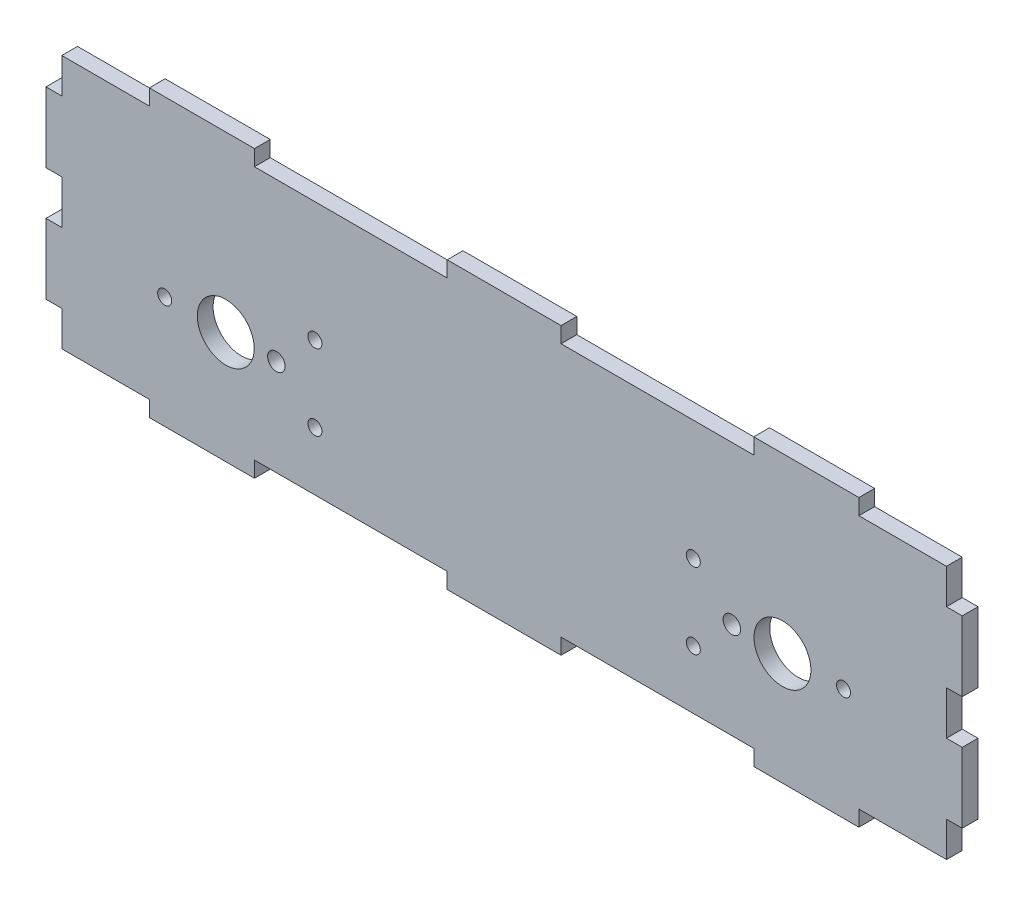
from build123d import *

# Parameters (mm, degrees)
SKETCH_1_W             = 170
SKETCH_1_H             = 48
SKETCH_1_R             = 2
SKETCH_1_R_2           = 6.5
SKETCH_1_R_3           = 1.6
SM_BASE_FLANGE_1_DEPTH = 3.6
SKETCH_7_W             = 16
SKETCH_7_H             = 48
EXTRUDE_1_DEPTH        = 3.6
SKETCH_8_W             = 202
SKETCH_8_H             = 10
EXTRUDE_2_DEPTH        = 3.6
SKETCH_9_W             = 3.6
SKETCH_9_H             = 16
SKETCH_9_W_2           = 24
SKETCH_9_H_2           = 3.6
SKETCH_9_W_3           = 26
EXTRUDE_3_DEPTH        = 3.6


# Sheet-metal steps are written as plain solids
with BuildPart() as part:
    # Sketch 1 → Базовая кромка1 (new body)
    with BuildSketch(Plane.XY):
        with Locations((85, 24)):
            Rectangle(SKETCH_1_W, SKETCH_1_H)
        with Locations((137, 12)):
            Circle(SKETCH_1_R, mode=Mode.SUBTRACT)
        with Locations((33, 12)):
            Circle(SKETCH_1_R, mode=Mode.SUBTRACT)
        with Locations((148.55, 12)):
            Circle(SKETCH_1_R_2, mode=Mode.SUBTRACT)
        with Locations((21.45, 12)):
            Circle(SKETCH_1_R_2, mode=Mode.SUBTRACT)
        with Locations((128.2, 20.65)):
            Circle(SKETCH_1_R_3, mode=Mode.SUBTRACT)
        with Locations((128.2, 3.35)):
            Circle(SKETCH_1_R_3, mode=Mode.SUBTRACT)
        with Locations((41.8, 20.65)):
            Circle(SKETCH_1_R_3, mode=Mode.SUBTRACT)
        with Locations((41.8, 3.35)):
            Circle(SKETCH_1_R_3, mode=Mode.SUBTRACT)
        with Locations((162.5, 12)):
            Circle(SKETCH_1_R_3, mode=Mode.SUBTRACT)
        with Locations((7.5, 12)):
            Circle(SKETCH_1_R_3, mode=Mode.SUBTRACT)
    extrude(amount=-SM_BASE_FLANGE_1_DEPTH)

    # Эскиз7 → Бобышка-Вытянуть1 (add)
    with BuildSketch(Plane(origin=(0, 0, -3.6), x_dir=(-1, 0, 0), z_dir=(0, 0, -1))):
        with Locations((-178, 24)):
            Rectangle(SKETCH_7_W, SKETCH_7_H)
        with Locations((8, 24)):
            Rectangle(SKETCH_7_W, SKETCH_7_H)
    extrude(amount=-EXTRUDE_1_DEPTH)

    # Эскиз8 → Бобышка-Вытянуть2 (add)
    with BuildSketch(Plane(origin=(0, 0, -3.6), x_dir=(-1, 0, 0), z_dir=(0, 0, -1))):
        with Locations((-85, -5)):
            Rectangle(SKETCH_8_W, SKETCH_8_H)
    extrude(amount=-EXTRUDE_2_DEPTH)

    # Эскиз9 → Бобышка-Вытянуть3 (add)
    with BuildSketch(Plane(origin=(0, 0, -3.6), x_dir=(-1, 0, 0), z_dir=(0, 0, -1))):
        with Locations((-187.8, 32)):
            Rectangle(SKETCH_9_W, SKETCH_9_H)
        with Locations((-187.8, 6)):
            Rectangle(SKETCH_9_W, SKETCH_9_H)
        with Locations((-154, 49.8)):
            Rectangle(SKETCH_9_W_2, SKETCH_9_H_2)
        with Locations((-85, 49.8)):
            Rectangle(SKETCH_9_W_3, SKETCH_9_H_2)
        with Locations((-16, 49.8)):
            Rectangle(SKETCH_9_W_2, SKETCH_9_H_2)
        with Locations((17.8, 32)):
            Rectangle(SKETCH_9_W, SKETCH_9_H)
        with Locations((17.8, 6)):
            Rectangle(SKETCH_9_W, SKETCH_9_H)
        with Locations((-16, -11.8)):
            Rectangle(SKETCH_9_W_2, SKETCH_9_H_2)
        with Locations((-85, -11.8)):
            Rectangle(SKETCH_9_W_3, SKETCH_9_H_2)
        with Locations((-154, -11.8)):
            Rectangle(SKETCH_9_W_2, SKETCH_9_H_2)
    extrude(amount=-EXTRUDE_3_DEPTH)


solid = part.part
